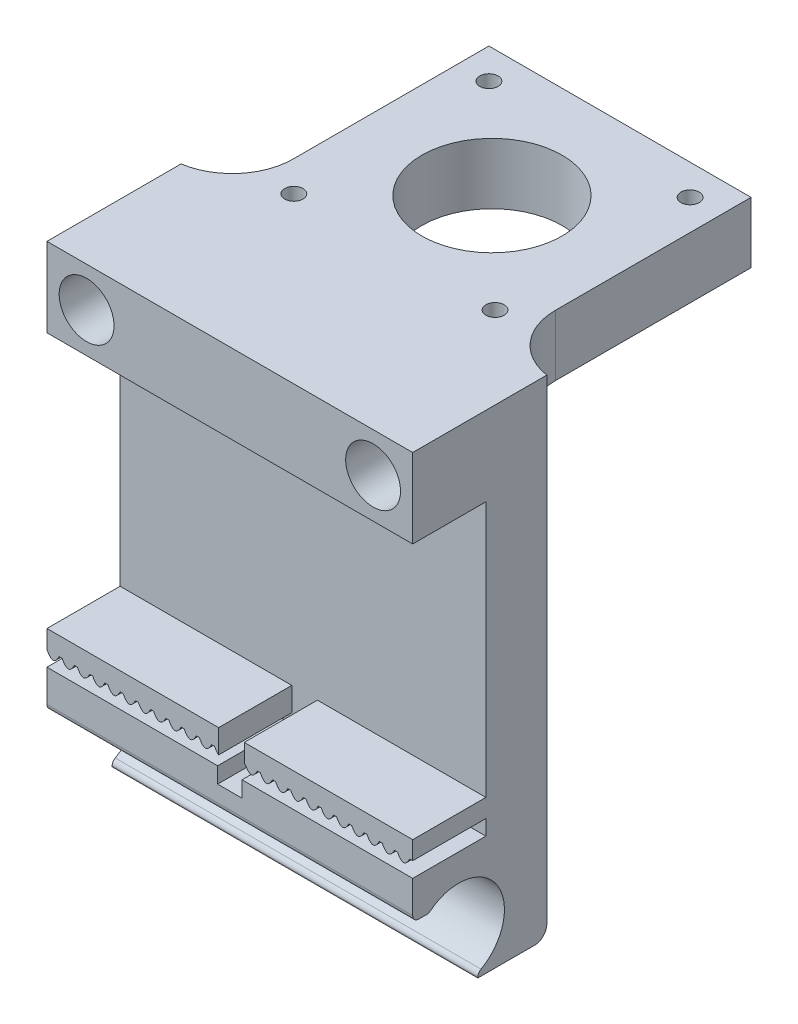
from build123d import *

# Parameters (mm, degrees)
SKETCH_1_W           = 60
SKETCH_1_H           = 80
EXTRUDE_1_DEPTH      = 10
SKETCH_2_W           = 60
SKETCH_2_H           = 13
SKETCH_2_R           = 4
EXTRUDE_2_DEPTH      = 12
SKETCH_3_W           = 60
SKETCH_3_H           = 20
EXTRUDE_3_DEPTH      = 12
SKETCH_6_R           = 7.5
CUT_EXTRUDE_1_DEPTH  = 60
CUT_EXTRUDE_3_DEPTH  = 60
CUT_EXTRUDE_6_DEPTH  = 60
FILLET_11_R          = 1
SKETCH_11_W          = 60
SKETCH_11_H          = 3.5
EXTRUDE_4_DEPTH      = 12
SKETCH_14_W          = 4
SKETCH_14_H          = 1.5
CUT_EXTRUDE_8_DEPTH  = 22
FILLET_12_R          = 2
SKETCH_15_W          = 12
SKETCH_15_H          = 0.5
CUT_EXTRUDE_9_DEPTH  = 103.391405889
EXTRUDE_5_DEPTH      = 20
SKETCH_19_W          = 60
SKETCH_19_H          = 0.5
SKETCH_19_W_2        = 4.202746251
SKETCH_19_H_2        = 4
CUT_EXTRUDE_10_DEPTH = 12
SKETCH_21_W          = 4
SKETCH_21_H          = 1.112257447
CUT_EXTRUDE_12_DEPTH = 103.391405948
SKETCH_22_R          = 4.5
CUT_EXTRUDE_14_DEPTH = 12
SKETCH_23_R          = 1.5
EXTRUDE_6_DEPTH      = 10
FILLET_13_R          = 10


with BuildPart() as part:
    # 스케치1 → 보스-돌출1 (new body)
    with BuildSketch(Plane.XY):
        with Locations((-30, 40)):
            Rectangle(SKETCH_1_W, SKETCH_1_H)
    extrude(amount=EXTRUDE_1_DEPTH)

    # 스케치2 → 보스-돌출2 (add)
    with BuildSketch(Plane.XY.offset(10)):
        with Locations((-30, 73.5)):
            Rectangle(SKETCH_2_W, SKETCH_2_H)
        with Locations((-6.5, 73.5)):
            Circle(SKETCH_2_R, mode=Mode.SUBTRACT)
        with Locations((-53.5, 73.5)):
            Circle(SKETCH_2_R, mode=Mode.SUBTRACT)
    extrude(amount=EXTRUDE_2_DEPTH)

    # 스케치3 → 보스-돌출3 (add)
    with BuildSketch(Plane.XY.offset(10)):
        with Locations((-30, 10)):
            Rectangle(SKETCH_3_W, SKETCH_3_H)
    extrude(amount=EXTRUDE_3_DEPTH)

    # 스케치6 → 컷-돌출1 (cut)
    with BuildSketch(Plane(origin=(0, 0, 0), x_dir=(0, 0, -1), z_dir=(1, 0, 0))):
        with Locations(Location((-14.4537136, 7.550140621, 0), (0, 0, 90))):
            Circle(SKETCH_6_R)
    extrude(amount=-CUT_EXTRUDE_1_DEPTH, mode=Mode.SUBTRACT)

    # 스케치8 → 컷-돌출3 (cut)
    with BuildSketch(Plane(origin=(0, 0, 0), x_dir=(0, 0, -1), z_dir=(1, 0, 0))):
        Polygon((-14.254234553, 0), (-22, 0), (-22, 7.752485681), align=None)
    extrude(amount=-CUT_EXTRUDE_3_DEPTH, mode=Mode.SUBTRACT)

    # 스케치10 → 컷-돌출6 (cut)
    with BuildSketch(Plane(origin=(0, 0, 0), x_dir=(0, 0, -1), z_dir=(1, 0, 0))):
        Polygon((-19.367836468, 13.215950046), (-22, 13.215950046), (-22, 7.475911399), align=None)
        Polygon((-11.311841371, 0), (-15.135533844, 0), (-11.311841371, 1.431872303), align=None)
    extrude(amount=-CUT_EXTRUDE_6_DEPTH, mode=Mode.SUBTRACT)

    # 필렛11
    fillet_11_edges = [part.edges().sort_by_distance(p)[0] for p in [
        (-30, 0.739954215, 11.311841371),
        (-30, 13.215950046, 19.367836468),
        (-30, 13.215950046, 22),
    ]]
    fillet(fillet_11_edges, radius=FILLET_11_R)

    # 스케치11 → 보스-돌출4 (add)
    with BuildSketch(Plane.XY.offset(10)):
        with Locations((-30, 23.25)):
            Rectangle(SKETCH_11_W, SKETCH_11_H)
    extrude(amount=EXTRUDE_4_DEPTH)

    # 스케치14 → 컷-돌출8 (cut)
    with BuildSketch(Plane.XY.offset(22)):
        with Locations((-30, 17.637742553)):
            Rectangle(SKETCH_14_W, SKETCH_14_H)
    extrude(amount=-CUT_EXTRUDE_8_DEPTH, mode=Mode.SUBTRACT)

    # 필렛12
    fillet_12_edges = [part.edges().sort_by_distance(p)[0] for p in [
        (-30, 0, 0),
    ]]
    fillet(fillet_12_edges, radius=FILLET_12_R)

    # 스케치15 → 컷-돌출9 (cut, through all)
    with BuildSketch(Plane.ZY.offset(60)):
        with Locations((16, 21.75)):
            Rectangle(SKETCH_15_W, SKETCH_15_H)
    extrude(amount=-CUT_EXTRUDE_9_DEPTH, mode=Mode.SUBTRACT)

    # 스케치18 → 보스-돌출5 (add)
    with BuildSketch(Plane.XY.offset(22)):
        with BuildLine():
            Line((-60, 22), (-58, 22))
            add(Edge.make_bspline(
                [(-60, 22), (-59, 20), (-58, 22)],
                knots=[0, 0, 0, 1, 1, 1], degree=2))
        make_face()
        with BuildLine():
            Line((-57.5, 22), (-55.5, 22))
            add(Edge.make_bspline(
                [(-57.5, 22), (-56.5, 20), (-55.5, 22)],
                knots=[0, 0, 0, 1, 1, 1], degree=2))
        make_face()
        with BuildLine():
            Line((-55, 22), (-53, 22))
            add(Edge.make_bspline(
                [(-55, 22), (-54, 20), (-53, 22)],
                knots=[0, 0, 0, 1, 1, 1], degree=2))
        make_face()
        with BuildLine():
            Line((-52.5, 22), (-50.5, 22))
            add(Edge.make_bspline(
                [(-52.5, 22), (-51.5, 20), (-50.5, 22)],
                knots=[0, 0, 0, 1, 1, 1], degree=2))
        make_face()
        with BuildLine():
            Line((-50, 22), (-48, 22))
            add(Edge.make_bspline(
                [(-50, 22), (-49, 20), (-48, 22)],
                knots=[0, 0, 0, 1, 1, 1], degree=2))
        make_face()
        with BuildLine():
            Line((-47.5, 22), (-45.5, 22))
            add(Edge.make_bspline(
                [(-47.5, 22), (-46.5, 20), (-45.5, 22)],
                knots=[0, 0, 0, 1, 1, 1], degree=2))
        make_face()
        with BuildLine():
            Line((-45, 22), (-43, 22))
            add(Edge.make_bspline(
                [(-45, 22), (-44, 20), (-43, 22)],
                knots=[0, 0, 0, 1, 1, 1], degree=2))
        make_face()
        with BuildLine():
            Line((-42.5, 22), (-40.5, 22))
            add(Edge.make_bspline(
                [(-42.5, 22), (-41.5, 20), (-40.5, 22)],
                knots=[0, 0, 0, 1, 1, 1], degree=2))
        make_face()
        with BuildLine():
            Line((-40, 22), (-38, 22))
            add(Edge.make_bspline(
                [(-40, 22), (-39, 20), (-38, 22)],
                knots=[0, 0, 0, 1, 1, 1], degree=2))
        make_face()
        with BuildLine():
            Line((-37.5, 22), (-35.5, 22))
            add(Edge.make_bspline(
                [(-37.5, 22), (-36.5, 20), (-35.5, 22)],
                knots=[0, 0, 0, 1, 1, 1], degree=2))
        make_face()
        with BuildLine():
            Line((-35, 22), (-33, 22))
            add(Edge.make_bspline(
                [(-35, 22), (-34, 20), (-33, 22)],
                knots=[0, 0, 0, 1, 1, 1], degree=2))
        make_face()
        with BuildLine():
            Line((-32.5, 22), (-30.5, 22))
            add(Edge.make_bspline(
                [(-32.5, 22), (-31.5, 20), (-30.5, 22)],
                knots=[0, 0, 0, 1, 1, 1], degree=2))
        make_face()
        with BuildLine():
            Line((-30, 22), (-28, 22))
            add(Edge.make_bspline(
                [(-30, 22), (-29, 20), (-28, 22)],
                knots=[0, 0, 0, 1, 1, 1], degree=2))
        make_face()
        with BuildLine():
            Line((-27.5, 22), (-25.5, 22))
            add(Edge.make_bspline(
                [(-27.5, 22), (-26.5, 20), (-25.5, 22)],
                knots=[0, 0, 0, 1, 1, 1], degree=2))
        make_face()
        with BuildLine():
            Line((-25, 22), (-23, 22))
            add(Edge.make_bspline(
                [(-25, 22), (-24, 20), (-23, 22)],
                knots=[0, 0, 0, 1, 1, 1], degree=2))
        make_face()
        with BuildLine():
            Line((-22.5, 22), (-20.5, 22))
            add(Edge.make_bspline(
                [(-22.5, 22), (-21.5, 20), (-20.5, 22)],
                knots=[0, 0, 0, 1, 1, 1], degree=2))
        make_face()
        with BuildLine():
            Line((-20, 22), (-18, 22))
            add(Edge.make_bspline(
                [(-20, 22), (-19, 20), (-18, 22)],
                knots=[0, 0, 0, 1, 1, 1], degree=2))
        make_face()
        with BuildLine():
            Line((-17.5, 22), (-15.5, 22))
            add(Edge.make_bspline(
                [(-17.5, 22), (-16.5, 20), (-15.5, 22)],
                knots=[0, 0, 0, 1, 1, 1], degree=2))
        make_face()
        with BuildLine():
            Line((-15, 22), (-13, 22))
            add(Edge.make_bspline(
                [(-15, 22), (-14, 20), (-13, 22)],
                knots=[0, 0, 0, 1, 1, 1], degree=2))
        make_face()
        with BuildLine():
            Line((-12.5, 22), (-10.5, 22))
            add(Edge.make_bspline(
                [(-12.5, 22), (-11.5, 20), (-10.5, 22)],
                knots=[0, 0, 0, 1, 1, 1], degree=2))
        make_face()
        with BuildLine():
            Line((-10, 22), (-8, 22))
            add(Edge.make_bspline(
                [(-10, 22), (-9, 20), (-8, 22)],
                knots=[0, 0, 0, 1, 1, 1], degree=2))
        make_face()
        with BuildLine():
            Line((-7.5, 22), (-5.5, 22))
            add(Edge.make_bspline(
                [(-7.5, 22), (-6.5, 20), (-5.5, 22)],
                knots=[0, 0, 0, 1, 1, 1], degree=2))
        make_face()
        with BuildLine():
            Line((-5, 22), (-3, 22))
            add(Edge.make_bspline(
                [(-5, 22), (-4, 20), (-3, 22)],
                knots=[0, 0, 0, 1, 1, 1], degree=2))
        make_face()
        with BuildLine():
            Line((-2.5, 22), (-0.5, 22))
            add(Edge.make_bspline(
                [(-2.5, 22), (-1.5, 20), (-0.5, 22)],
                knots=[0, 0, 0, 1, 1, 1], degree=2))
        make_face()
    extrude(amount=-EXTRUDE_5_DEPTH)

    # 스케치19 → 컷-돌출10 (cut)
    with BuildSketch(Plane.XY.offset(22)):
        with Locations((-30, 19.75)):
            Rectangle(SKETCH_19_W, SKETCH_19_H)
        with Locations((-29.736082812, 23)):
            Rectangle(SKETCH_19_W_2, SKETCH_19_H_2)
    extrude(amount=-CUT_EXTRUDE_10_DEPTH, mode=Mode.SUBTRACT)

    # 스케치21 → 컷-돌출12 (cut, through all)
    with BuildSketch(Plane.XY.offset(22)):
        with Locations((-30, 18.943871277)):
            Rectangle(SKETCH_21_W, SKETCH_21_H)
    extrude(amount=-CUT_EXTRUDE_12_DEPTH, mode=Mode.SUBTRACT)

    # 스케치22 → 컷-돌출14 (cut)
    with BuildSketch(Plane.XY.offset(22)):
        with Locations((-53.5, 73.5)):
            Circle(SKETCH_22_R)
        with Locations((-6.5, 73.5)):
            Circle(SKETCH_22_R)
    extrude(amount=-CUT_EXTRUDE_14_DEPTH, mode=Mode.SUBTRACT)

    # 스케치23 → 보스-돌출6 (add)
    # profile 1 of 3: a face of its own
    with BuildSketch(Plane(origin=(0, 80, 0), x_dir=(1, 0, 0), z_dir=(0, 1, 0))):
        with BuildLine():
            Line((-30, 0), (-8.499392674, 0))
            Line((-8.499392674, 0), (-8.499392674, 42))
            Line((-8.499392674, 42), (-30, 42))
            Line((-30, 42), (-30, 32.5))
            ThreePointArc((-30, 32.5), (-21.868272016, 29.131727984), (-18.5, 21))
            ThreePointArc((-18.5, 21), (-21.868272016, 12.868272016), (-30, 9.5))
            Line((-30, 9.5), (-30, 0))
        make_face()
        with Locations(Location((-13.499392674, 5, 0), (0, 0, 180))):
            Circle(SKETCH_23_R, mode=Mode.SUBTRACT)
        with Locations(Location((-13.499392674, 37, 0), (0, 0, 180))):
            Circle(SKETCH_23_R, mode=Mode.SUBTRACT)
    # profile 2 of 3: a face of its own
    with BuildSketch(Plane(origin=(0, 80, 0), x_dir=(1, 0, 0), z_dir=(0, 1, 0))):
        with BuildLine():
            Line((-46.500607326, 0), (-30, 0))
            Line((-30, 0), (-30, 9.5))
            ThreePointArc((-30, 9.5), (-41.5, 21), (-30, 32.5))
            Line((-30, 32.5), (-30, 42))
            Line((-30, 42), (-51.500607326, 42))
            Line((-51.500607326, 42), (-51.500607326, 5))
            Line((-51.500607326, 5), (-48.000607326, 5))
            ThreePointArc((-48.000607326, 5), (-46.500607326, 6.5), (-45.000607326, 5))
            ThreePointArc((-45.000607326, 5), (-45.439947155, 3.939339828), (-46.500607326, 3.5))
            Line((-46.500607326, 3.5), (-46.500607326, 0))
        make_face()
        with Locations(Location((-46.500607326, 37, 0), (0, 0, 180))):
            Circle(SKETCH_23_R, mode=Mode.SUBTRACT)
    # profile 3 of 3: a face of its own
    with BuildSketch(Plane(origin=(0, 80, 0), x_dir=(1, 0, 0), z_dir=(0, 1, 0))):
        with BuildLine():
            Line((-51.500607326, 0), (-46.500607326, 0))
            Line((-46.500607326, 0), (-46.500607326, 3.5))
            ThreePointArc((-46.500607326, 3.5), (-47.561267498, 3.939339828), (-48.000607326, 5))
            Line((-48.000607326, 5), (-51.500607326, 5))
            Line((-51.500607326, 5), (-51.500607326, 0))
        make_face()
    extrude(amount=-EXTRUDE_6_DEPTH)

    # 필렛13
    # the kernel refuses this fillet: 10 mm, written as the material it adds along each edge
    with BuildSketch(Plane(origin=(-8.499392674, 80, 0), x_dir=(1, 0, 0), z_dir=(0, -1, 0))) as fillet_13_piece_1:
        with BuildLine():
            CenterArc((10, -9.886767806), FILLET_13_R, 98.630446119, 81.369553881)
            Line((0, -9.886767806), (-0.2, -9.886767806))
            Line((-0.2, -9.886767806), (-0.2, 0))
            Line((-0.2, 0), (0, 0.2))
            ThreePointArc((0, 0.2), (4.249696337, 0.2), (8.469380527, 0.197735356))
            Line((8.469380527, 0.197735356), (8.499392674, 0))
        make_face()
    extrude(amount=10)
    with BuildSketch(Plane(origin=(-51.500607326, 80, 0), x_dir=(-1, 0, 0), z_dir=(0, -1, 0))) as fillet_13_piece_2:
        with BuildLine():
            CenterArc((10, 9.886767806), FILLET_13_R, 180, 81.369553881)
            Line((0, 9.886767806), (-0.2, 9.886767806))
            Line((-0.2, 9.886767806), (-0.2, 0))
            Line((-0.2, 0), (0, -0.2))
            ThreePointArc((0, -0.2), (4.249696337, -0.2), (8.469380527, -0.197735356))
            Line((8.469380527, -0.197735356), (8.499392674, 0))
        make_face()
    extrude(amount=10)


solid = part.part
